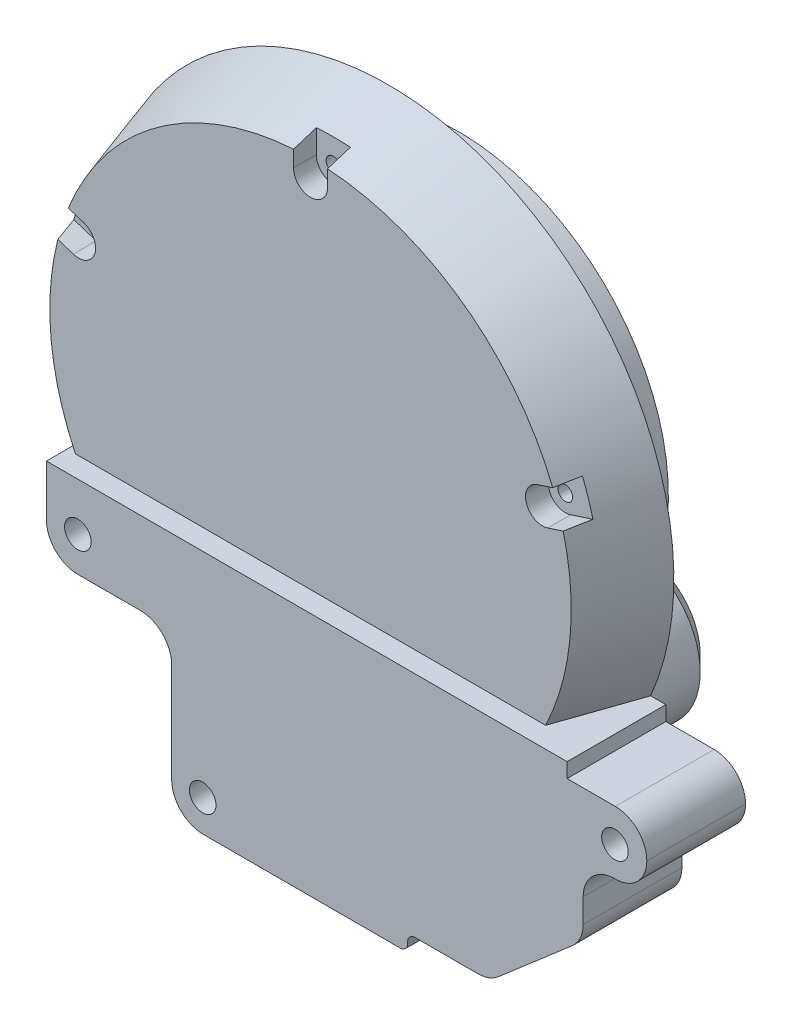
from build123d import *

# Parameters (mm, degrees)
SKETCH1_R                  = 98.2726
EXTRUDE1_DEPTH             = 26.8732
EXTRUDE1_TAPER             = 17.5
SKETCH2_R                  = 2.5
EXTRUDE2_DEPTH             = 22.8854
EXTRUDE3_DEPTH             = 7.874
SKETCH4_W                  = 246.961047875
SKETCH4_H                  = 84.3534
EXTRUDE4_DEPTH             = 7.1374
EXTRUDE4_DIRECTION_2_REACH = 143.553
EXTRUDE5_DEPTH             = 34.0106
EXTRUDE6_DEPTH             = 34.0106
SKETCH8_R                  = 25.7175
EXTRUDE7_DEPTH             = 38.989
SKETCH9_R                  = 79.248
EXTRUDE9_DEPTH             = 9.6012
SKETCH10_R                 = 72.39
EXTRUDE10_DEPTH            = 14.4018
SKETCH11_R                 = 37.592
EXTRUDE11_DEPTH            = 18.9992
SKETCH12_R                 = 13.9065
EXTRUDE12_DEPTH            = 21.717
EXTRUDE13_DEPTH            = 22.4028
CHAMFER1_SIZE              = 5.08
FILLET1_R                  = 10.8331
FILLET2_R                  = 2.54
SKETCH17_R                 = 4.572
EXTRUDE14_DEPTH            = 191.331955682
EXTRUDE15_START            = 3.2639
SKETCH18_R                 = 19.05
SKETCH18_R_2               = 13.9065
EXTRUDE15_DEPTH            = 3.2639


with BuildPart() as part:
    # Sketch1 → Extrude1 (new body)
    with BuildSketch(Plane.XY):
        Circle(SKETCH1_R)
    extrude(amount=EXTRUDE1_DEPTH, taper=EXTRUDE1_TAPER)

    # Sketch2 → Extrude2 (cut)
    with BuildSketch(Plane.XY.offset(26.8732)):
        with Locations((0, 83.9978)):
            Circle(SKETCH2_R)
        with Locations((-79.888747369, 25.957427527)):
            Circle(SKETCH2_R)
        with Locations((79.888747369, 25.957427527)):
            Circle(SKETCH2_R)
    extrude(amount=-EXTRUDE2_DEPTH, mode=Mode.SUBTRACT)

    # Sketch3 → Extrude3 (cut)
    with BuildSketch(Plane.XY.offset(26.8732)):
        with BuildLine():
            Line((-5.8547, 83.9978), (-5.8547, 107.083482694))
            Line((-5.8547, 107.083482694), (5.8547, 107.083482694))
            Line((5.8547, 107.083482694), (5.8547, 83.9978))
            ThreePointArc((5.8547, 83.9978), (0, 78.1431), (-5.8547, 83.9978))
        make_face()
        with BuildLine():
            Line((78.079545572, 31.525578113), (107.519879311, 41.091322409))
            Line((107.519879311, 41.091322409), (110.140650445, 33.912588651))
            Line((110.140650445, 33.912588651), (111.136243984, 29.954358751))
            Line((111.136243984, 29.954358751), (81.697949166, 20.389276942))
            ThreePointArc((81.697949166, 20.389276942), (74.320596783, 24.148225731), (78.079545572, 31.525578113))
        make_face()
        with BuildLine():
            Line((-78.079545572, 31.525578113), (-100.241812355, 38.726535104))
            Line((-100.241812355, 38.726535104), (-103.860215949, 27.590233933))
            Line((-103.860215949, 27.590233933), (-81.697949166, 20.389276942))
            ThreePointArc((-81.697949166, 20.389276942), (-74.320596783, 24.148225731), (-78.079545572, 31.525578113))
        make_face()
    extrude(amount=-EXTRUDE3_DEPTH, mode=Mode.SUBTRACT)

    # Sketch4 → Extrude4 (add)
    with BuildSketch(Plane.XY.offset(26.8732)):
        with Locations((9.213520109, -81.0133)):
            Rectangle(SKETCH4_W, SKETCH4_H)
    extrude(amount=EXTRUDE4_DEPTH)

    # Extrude4 direction 2: up to this face of the body (flat: up to its plane)
    extrude4_direction_2_end = Plane(part.part.faces().sort_by_distance((0, 0, 0))[0])
    # Sketch4 → Extrude4 direction 2 (add, up to the picked face)
    with BuildSketch(Plane.XY.offset(26.8732), mode=Mode.PRIVATE) as extrude4_direction_2_sk1:
        with Locations((9.213520109, -81.0133)):
            Rectangle(SKETCH4_W, SKETCH4_H)
    extrude4_direction_2_tool1 = split(extrude(extrude4_direction_2_sk1.sketch, amount=-EXTRUDE4_DIRECTION_2_REACH, mode=Mode.PRIVATE), bisect_by=extrude4_direction_2_end, keep=Keep.BOTH, mode=Mode.PRIVATE)
    add(extrude4_direction_2_tool1.solids().sort_by(Axis((9.21352, -81.0133, 26.8732), (0, 0, -1)))[0])

    # Sketch5 → Extrude5 (cut)
    with BuildSketch(Plane.XY.offset(34.0106)):
        Polygon((-83.82, -67.2338), (-40.6908, -67.2338), (-40.6908, -176.31524759), (-133.730255454, -176.31524759), (-133.730255454, -141.532127837), (-175.240717896, -141.532127837), (-175.240717896, -38.8366), (-83.82, -38.8366), align=None)
    extrude(amount=-EXTRUDE5_DEPTH, mode=Mode.SUBTRACT)

    # Sketch6 → Extrude6 (cut)
    with BuildSketch(Plane.XY.offset(34.0106)):
        Polygon((40.5892, -117.475), (68.7832, -117.475), (101.0412, -89.6112), (101.0412, -65.5574), (122.9614, -65.5574), (122.9614, -43.8912), (95.504, -43.8912), (95.504, -38.8366), (122.9614, -38.8366), (122.9614, 0), (187.241229942, 0), (187.241229942, -89.6112), (148.373467802, -89.6112), (148.373467802, -112.172308269), (148.373467802, -172.462981515), (68.7832, -172.462981515), (40.5892, -172.462981515), align=None)
    extrude(amount=-EXTRUDE6_DEPTH, mode=Mode.SUBTRACT)

    # Sketch8 → Extrude7 (add)
    with BuildSketch(Plane(origin=(0, 0, 0), x_dir=(-1, 0, 0), z_dir=(0, 0, -1))):
        with Locations(Location((0, -79.0956, 0), (0, 0, 180))):
            Circle(SKETCH8_R)
        with Locations(Location((-47.7266, -57.0992, 0), (0, 0, 180))):
            Circle(SKETCH8_R)
    extrude(amount=EXTRUDE7_DEPTH)

    # Sketch9 → Extrude9 (add)
    with BuildSketch(Plane(origin=(0, 0, 0), x_dir=(-1, 0, 0), z_dir=(0, 0, -1))):
        Circle(SKETCH9_R)
    extrude(amount=EXTRUDE9_DEPTH)

    # Sketch10 → Extrude10 (add)
    with BuildSketch(Plane(origin=(0, 0, -9.6012), x_dir=(-1, 0, 0), z_dir=(0, 0, -1))):
        Circle(SKETCH10_R)
    extrude(amount=EXTRUDE10_DEPTH)

    # Sketch11 → Extrude11 (add)
    with BuildSketch(Plane(origin=(0, 0, -24.003), x_dir=(-1, 0, 0), z_dir=(0, 0, -1))):
        Circle(SKETCH11_R)
    extrude(amount=EXTRUDE11_DEPTH)

    # Sketch12 → Extrude12 (cut)
    with BuildSketch(Plane(origin=(0, 0, -43.0022), x_dir=(-1, 0, 0), z_dir=(0, 0, -1))):
        Circle(SKETCH12_R)
    extrude(amount=-EXTRUDE12_DEPTH, mode=Mode.SUBTRACT)

    # Sketch13 → Extrude13 (add)
    with BuildSketch(Plane(origin=(0, 0, 0), x_dir=(-1, 0, 0), z_dir=(0, 0, -1))):
        with BuildLine():
            Line((-58.491115046, -80.455463016), (-10.764515046, -102.451863016))
            ThreePointArc((-10.764515046, -102.451863016), (23.356263016, -89.860115046), (10.764515046, -55.739336984))
            Line((10.764515046, -55.739336984), (-36.962084954, -33.742936984))
            ThreePointArc((-36.962084954, -33.742936984), (-71.082863016, -46.334684954), (-58.491115046, -80.455463016))
        make_face()
    extrude(amount=EXTRUDE13_DEPTH)

    # Chamfer1
    chamfer1_edges = [part.edges().sort_by_distance(p)[0] for p in [
        (-25.7175, -79.0956, -38.989),
        (22.0091, -57.0992, -38.989),
    ]]
    chamfer(chamfer1_edges, length=CHAMFER1_SIZE)

    # Fillet1
    # the kernel refuses this fillet: 10.8331 mm, written as the material it adds along each edge
    with BuildSketch(Plane(origin=(101.0412, -65.5574, 34.0106), x_dir=(1, 0, 0), z_dir=(0, 0, -1)), Plane(origin=(-40.6908, -67.2338, 34.0106), x_dir=(0, -1, 0), z_dir=(0, 0, -1))) as fillet1_piece_1:
        with BuildLine():
            CenterArc((FILLET1_R, FILLET1_R), FILLET1_R, 180, 90)
            Line((0, FILLET1_R), (0, 0))
            Line((0, 0), (FILLET1_R, 0))
        make_face()
    extrude(amount=34.0106)
    # the kernel refuses this fillet: 10.8331 mm, written as the material it takes off along each edge
    with BuildSketch(Plane(origin=(122.9614, -65.5574, 61.09335), x_dir=(0, 1, 0), z_dir=(0, 0, -1)), Plane(origin=(122.9614, -43.8912, 61.09335), x_dir=(-1, 0, 0), z_dir=(0, 0, -1)), Plane(origin=(-83.82, -67.2338, 61.09335), x_dir=(1, 0, 0), z_dir=(0, 0, -1))) as fillet1_2_piece_1:
        with BuildLine():
            CenterArc((FILLET1_R, -FILLET1_R), FILLET1_R, 90, 90)
            Line((0, -FILLET1_R), (0, 0))
            Line((0, 0), (FILLET1_R, 0))
        make_face()
    extrude(amount=88.1761, mode=Mode.SUBTRACT)
    with BuildSketch(Plane(origin=(101.0412, -89.6112, 46.404396211), x_dir=(0, 1, 0), z_dir=(0, 0, -1))) as fillet1_2_piece_2:
        with BuildLine():
            CenterArc((FILLET1_R * 0.457626947463, -FILLET1_R), FILLET1_R, 90, 49.180218113)
            Line((-FILLET1_R * 0.299142463693, -FILLET1_R * 0.346318075561), (0, 0))
            Line((0, 0), (FILLET1_R * 0.457626947463, 0))
        make_face()
    extrude(amount=58.798192423, mode=Mode.SUBTRACT)
    with BuildSketch(Plane(origin=(68.7832, -117.475, 44.08790669), x_dir=(0.7567694111558876, 0.6536819244393799, 0), z_dir=(0, 0, -1))) as fillet1_2_piece_3:
        with BuildLine():
            CenterArc((FILLET1_R * 0.372093184392, -FILLET1_R), FILLET1_R, 90, 40.819781887)
            Line((-FILLET1_R * 0.281588740047, -FILLET1_R * 0.243230588844), (0, 0))
            Line((0, 0), (FILLET1_R * 0.372093184392, 0))
        make_face()
    extrude(amount=54.165213379, mode=Mode.SUBTRACT)
    with BuildSketch(Plane(origin=(-40.6908, -123.19, -27.08275), x_dir=(1, 0, 0), z_dir=(0, 0, 1))) as fillet1_2_piece_4:
        with BuildLine():
            CenterArc((FILLET1_R, FILLET1_R), FILLET1_R, 180, 90)
            Line((0, FILLET1_R), (0, 0))
            Line((0, 0), (FILLET1_R, 0))
        make_face()
    extrude(amount=88.1761, mode=Mode.SUBTRACT)

    # Fillet2
    fillet2_edges = [part.edges().sort_by_distance(p)[0] for p in [
        (40.5892, -123.19, 17.0053),
        (40.5892, -117.475, 17.0053),
    ]]
    fillet(fillet2_edges, radius=FILLET2_R)

    # Sketch17 → Extrude14 (cut, through all)
    with BuildSketch(Plane.XY.offset(34.0106)):
        with Locations((-72.9996, -55.2958)):
            Circle(SKETCH17_R)
        with Locations((112.000400002, -55.2958)):
            Circle(SKETCH17_R)
        with Locations((-29.999599996, -112.295800021)):
            Circle(SKETCH17_R)
    extrude(amount=-EXTRUDE14_DEPTH, mode=Mode.SUBTRACT)

    # Sketch18 → Extrude15 (add)
    with BuildSketch(Plane(origin=(0, 0, -43.0022), x_dir=(-1, 0, 0), z_dir=(0, 0, -1)).offset(EXTRUDE15_START)):
        with Locations(Location((0, 0, 0), (0, 0, 180))):
            Circle(SKETCH18_R)
        Circle(SKETCH18_R_2, mode=Mode.SUBTRACT)
    extrude(amount=-EXTRUDE15_DEPTH)


solid = part.part
